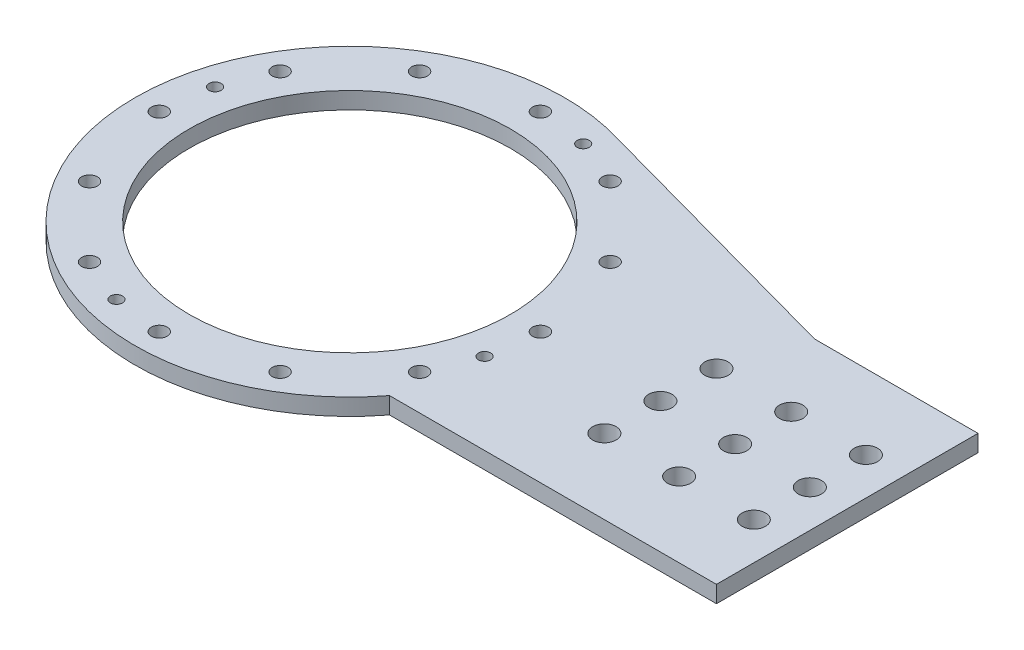
from build123d import *

# Parameters (mm, degrees)
SKETCH1_R           = 57.5
BOSS_EXTRUDE1_DEPTH = 4.5
SKETCH2_W           = 140
SKETCH2_H           = 70
BOSS_EXTRUDE2_DEPTH = 4.5
BOSS_EXTRUDE3_DEPTH = 4.5
SKETCH4_R           = 43
CUT_EXTRUDE1_DEPTH  = 146.08265961
SKETCH7_R           = 3.125
CUT_EXTRUDE8_DEPTH  = 146.08265961
LPATTERN1_COUNT     = 3
LPATTERN1_PITCH     = 20
SKETCH5_R           = 2.125
CUT_EXTRUDE5_DEPTH  = 146.08265961
CIRPATTERN1_COUNT   = 12
SKETCH12_R          = 1.625
CUT_EXTRUDE17_DEPTH = 146.08265961
CIRPATTERN2_COUNT   = 4
SKETCH13_R          = 3.125
CUT_EXTRUDE18_DEPTH = 10
LPATTERN2_COUNT     = 3
LPATTERN2_PITCH     = 20


with BuildPart() as part:
    # Sketch1 → Boss-Extrude1 (new body)
    with BuildSketch(Plane(origin=(0, 0, 0), x_dir=(1, 0, 0), z_dir=(0, 1, 0))):
        Circle(SKETCH1_R)
    extrude(amount=BOSS_EXTRUDE1_DEPTH)

    # Sketch2 → Boss-Extrude2 (add)
    with BuildSketch(Plane(origin=(0, 0, 0), x_dir=(1, 0, 0), z_dir=(0, 1, 0))):
        with Locations((63.125798099, 0)):
            Rectangle(SKETCH2_W, SKETCH2_H)
    extrude(amount=BOSS_EXTRUDE2_DEPTH)

    # Sketch3 → Boss-Extrude3 (add)
    with BuildSketch(Plane(origin=(0, 0, 0), x_dir=(1, 0, 0), z_dir=(0, 1, 0))):
        Polygon((89.373258538, 35), (13.76852627, 55.827212758), (13.76852627, 13.558751548), align=None)
    extrude(amount=BOSS_EXTRUDE3_DEPTH)

    # Sketch4 → Cut-Extrude1 (cut, through all)
    with BuildSketch(Plane(origin=(0, 4.5, 0), x_dir=(1, 0, 0), z_dir=(0, 1, 0))):
        Circle(SKETCH4_R)
    extrude(amount=-CUT_EXTRUDE1_DEPTH, mode=Mode.SUBTRACT)

    # Sketch7 → Cut-Extrude8 (cut, through all)
    with BuildSketch(Plane(origin=(0, 4.5, 0), x_dir=(1, 0, 0), z_dir=(0, 1, 0))):
        with Locations((123.125798099, 15)):
            Circle(SKETCH7_R)
        with Locations((123.125798099, -15)):
            Circle(SKETCH7_R)
    cut_extrude8 = extrude(amount=-CUT_EXTRUDE8_DEPTH, mode=Mode.SUBTRACT)

    # LPattern1: Cut-Extrude8 ×3
    with Locations(*[(-i * LPATTERN1_PITCH, 0, 0) for i in range(1, LPATTERN1_COUNT)]):
        add(cut_extrude8, mode=Mode.SUBTRACT)

    # Sketch5 → Cut-Extrude5 (cut, symmetric)
    with BuildSketch(Plane(origin=(0, 0, 0), x_dir=(1, 0, 0), z_dir=(0, 1, 0))):
        with Locations((-51, 0)):
            Circle(SKETCH5_R)
    cut_extrude5 = extrude(amount=CUT_EXTRUDE5_DEPTH, both=True, mode=Mode.SUBTRACT)

    # CirPattern1: Cut-Extrude5 ×12 about axis
    cirpattern1_axis = Axis((0, 4.5, 0), (0, 1, 0))
    for i in range(1, CIRPATTERN1_COUNT):
        add(cut_extrude5.rotate(cirpattern1_axis, i * 360 / CIRPATTERN1_COUNT), mode=Mode.SUBTRACT)

    # Sketch12 → Cut-Extrude17 (cut, through all)
    with BuildSketch(Plane(origin=(0, 4.5, 0), x_dir=(1, 0, 0), z_dir=(0, 1, 0))):
        with Locations((-49.262217141, 13.1997713)):
            Circle(SKETCH12_R)
    cut_extrude17 = extrude(amount=-CUT_EXTRUDE17_DEPTH, mode=Mode.SUBTRACT)

    # CirPattern2: Cut-Extrude17 ×4 about axis
    cirpattern2_axis = Axis((0, 4.5, 0), (0, 1, 0))
    for i in range(1, CIRPATTERN2_COUNT):
        add(cut_extrude17.rotate(cirpattern2_axis, i * 360 / CIRPATTERN2_COUNT), mode=Mode.SUBTRACT)

    # Sketch13 → Cut-Extrude18 (cut)
    with BuildSketch(Plane(origin=(0, 4.5, 0), x_dir=(1, 0, 0), z_dir=(0, 1, 0))):
        with Locations((123.125798099, 0)):
            Circle(SKETCH13_R)
    cut_extrude18 = extrude(amount=-CUT_EXTRUDE18_DEPTH, mode=Mode.SUBTRACT)

    # LPattern2: Cut-Extrude18 ×3
    with Locations(*[(-i * LPATTERN2_PITCH, 0, 0) for i in range(1, LPATTERN2_COUNT)]):
        add(cut_extrude18, mode=Mode.SUBTRACT)


solid = part.part
